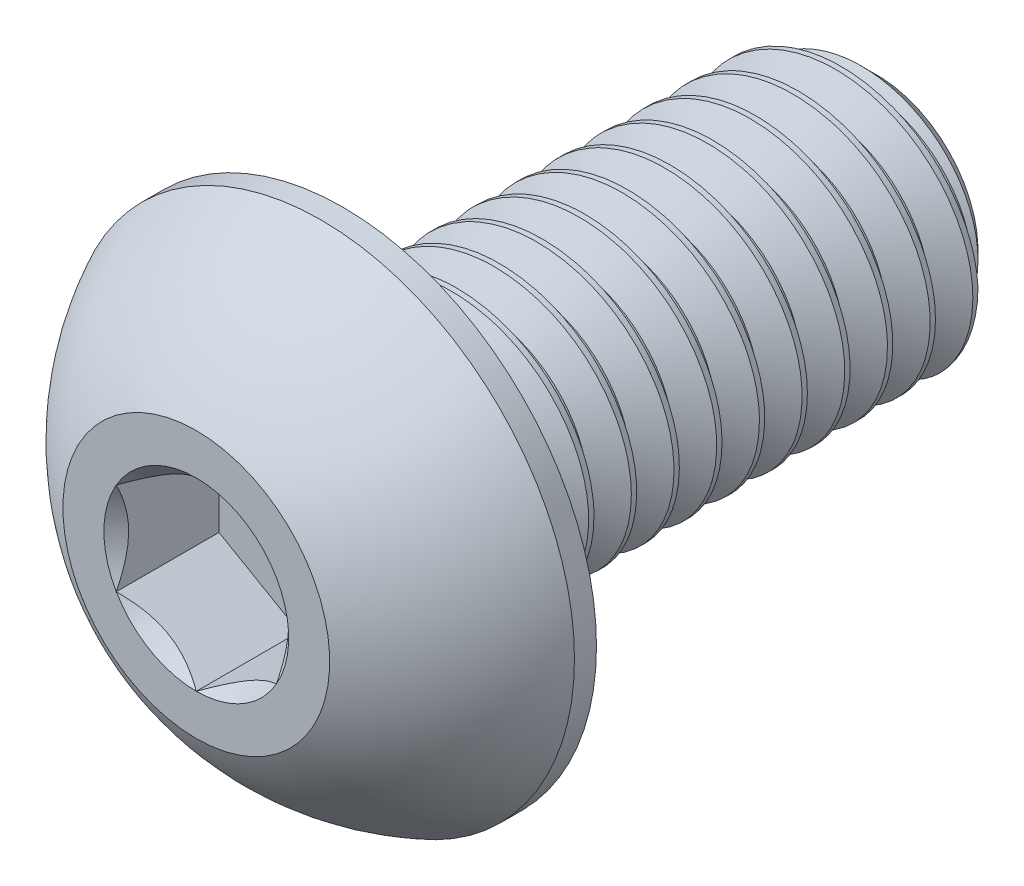
from build123d import *

# Parameters (mm, degrees)
CUT_EXTRUDE2_DEPTH = 1.925
CUT_SWEEP2_PITCH   = 0.8
CUT_SWEEP2_TO      = 10


with BuildPart() as part:
    # Sketch10 → Revolve3 (revolve)
    with BuildSketch(Plane(origin=(0, 0, 0), x_dir=(0, 0, -1), z_dir=(1, 0, 0)), mode=Mode.PRIVATE) as revolve3_sk:
        Polygon((4.4, 2.5), (5, 1.9), (5, 0), (-5, 0), (-5, 2.5), align=None)
    revolve(revolve3_sk.sketch.rotate(Axis((0, 0, 7.75), (0, 0, -1)), 180), axis=Axis((0, 0, 7.75), (0, 0, -1)))

    # Sketch7 → Revolve2 (revolve)
    with BuildSketch(Plane(origin=(0, 0, 0), x_dir=(0, 0, -1), z_dir=(1, 0, 0)), mode=Mode.PRIVATE) as revolve2_sk:
        with BuildLine():
            Line((-5.4125, 4.75), (-5, 4.75))
            Line((-5, 4.75), (-5, 0))
            Line((-5, 0), (-7.75, 0))
            Line((-7.75, 0), (-7.75, 2.5))
            ThreePointArc((-7.75, 2.5), (-6.758124817, 3.808753282), (-5.4125, 4.75))
        make_face()
    revolve(revolve2_sk.sketch.rotate(Axis((0, 0, 7.75), (0, 0, -1)), 180), axis=Axis((0, 0, 7.75), (0, 0, -1)))

    # Sketch5 → Cut-Extrude2 (cut)
    with BuildSketch(Plane.XY.offset(7.75)):
        Polygon((1.5, -0.866025404), (1.5, 0.866025404), (0, 1.732050808), (-1.5, 0.866025404), (-1.5, -0.866025404), (0, -1.732050808), align=None)
    extrude(amount=-CUT_EXTRUDE2_DEPTH, mode=Mode.SUBTRACT)

    # Cut-Extrude3 cone 1 section (through the dimple's axis) → Cut-Extrude3 (revolve, cut)
    with BuildSketch(Plane(origin=(0, 0, 7.75), x_dir=(0, -1, 0), z_dir=(1, 0, 0))):
        Polygon((0, 0), (1.732050808, 0), (0, 1.732050808), align=None)
    revolve(axis=Axis((0, 0, 7.75), (0, 0, -1)), mode=Mode.SUBTRACT)


with BuildPart() as body_2:
    # Split1: read off the stored shape, not the designer's step
    # Split1: the piece on the far side of the plane
    add(part.part)
    split(bisect_by=Plane.XY.offset(5), keep=Keep.BOTTOM)

    # Cut-Sweep2: arcs per turn and ends read off the stored shape
    # Cut-Sweep2: the profile of Sketch12 screwed along a right-hand helix through 17 turns, 8 arcs to a turn; built about Z, then put on its axis
    cut_sweep2_z = Axis((0, 0, 0), (0, 0, 1))
    cut_sweep2_corners = [(1.980384758, 0, -0.3), (1.980384758, 0, -0.4), (2.54330127, 0, -0.725), (2.54330127, 0, 0.025)]
    with BuildLine(mode=Mode.PRIVATE) as cut_sweep2_profile:
        Line(cut_sweep2_corners[0], cut_sweep2_corners[1])
        Line(cut_sweep2_corners[1], cut_sweep2_corners[2])
        Line(cut_sweep2_corners[2], cut_sweep2_corners[3])
        Line(cut_sweep2_corners[3], cut_sweep2_corners[0])
    cut_sweep2_cap = Face(cut_sweep2_profile.wire())
    cut_sweep2_turn_angles = [0, 22.5, 45, 67.5, 90, 112.5, 135, 157.5, 180, 202.5, 225, 247.5, 270, 292.5, 315, 337.5, 360]
    cut_sweep2_turn_weights = [1, 0.9238795325112867, 1, 0.9238795325112867, 1, 0.9238795325112867, 1, 0.9238795325112867, 1, 0.9238795325112867, 1, 0.9238795325112867, 1, 0.9238795325112867, 1, 0.9238795325112867, 1]
    cut_sweep2_turn_rails = [Edge.make_bspline([Vector(p[0], p[1], 0).rotate(cut_sweep2_z, cut_sweep2_turn_angles[k]) / cut_sweep2_turn_weights[k] + Vector(0, 0, p[2] + CUT_SWEEP2_PITCH * cut_sweep2_turn_angles[k] / 360) for k in range(17)], [0, 0, 0, 1, 1, 2, 2, 3, 3, 4, 4, 5, 5, 6, 6, 7, 7, 8, 8, 8], 2, cut_sweep2_turn_weights) for p in cut_sweep2_corners]
    cut_sweep2_turn_sides = [Face.make_surface_from_curves(cut_sweep2_turn_rails[p[0]], cut_sweep2_turn_rails[p[1]]) for p in [(0, 1), (1, 2), (2, 3), (3, 0)]]
    cut_sweep2 = Plane(origin=(0, 0, -5), x_dir=(0, 1, 0), z_dir=(0, 0, 1)) * split(Solid(Shell([*[p.moved(Location((0, 0, CUT_SWEEP2_PITCH * i))) for i in range(17) for p in cut_sweep2_turn_sides], cut_sweep2_cap, cut_sweep2_cap.rotate(cut_sweep2_z, 6120).moved(Location((0, 0, CUT_SWEEP2_PITCH * 6120 / 360)))])), bisect_by=Plane.XY.offset(CUT_SWEEP2_TO), keep=Keep.BOTTOM, mode=Mode.PRIVATE)
    add(cut_sweep2, mode=Mode.SUBTRACT)


with BuildPart() as part_1:
    add(part.part)

    # Split1
    split(bisect_by=Plane.XY.offset(5), keep=Keep.TOP)

    add(body_2.part)  # Boss-Extrude1 merges body 2
    # Boss-Extrude1: read off the stored shape, not the designer's step
    # Boss-Extrude1 outline → Boss-Extrude1 (revolve)
    with BuildSketch(Plane.XZ):
        Polygon((1.980384758, 5), (1.980384758, 4.480384758), (2.5, 5), align=None)
    revolve(axis=Axis((0, 0, 0), (0, 0, 1)))


solid = part_1.part
